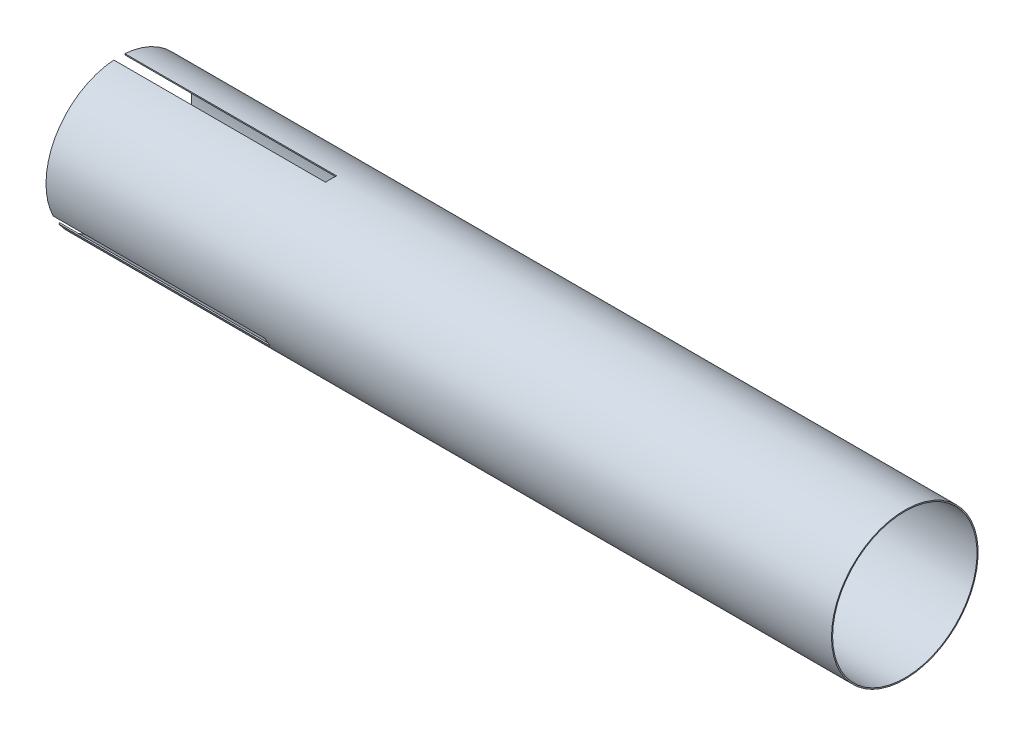
from build123d import *

# Parameters (mm, degrees)
ESQUISSE1_W                  = 816
ESQUISSE1_H                  = 1.182
ESQUISSE2_W                  = 220
ESQUISSE2_H                  = 11.482
ENL_V_MAT_EXTRU_1_DEPTH      = 824.081644947
R_P_TITION_CIRCULAIRE1_COUNT = 3
R_P_TITION_CIRCULAIRE1_ANGLE = 240


with BuildPart() as part:
    # Esquisse1 → Révolution1 (revolve)
    with BuildSketch(Plane.XY):
        with Locations((408, 75.591)):
            Rectangle(ESQUISSE1_W, ESQUISSE1_H)
    revolve(axis=Axis((0, 0, 0), (1, 0, 0)))

    # Esquisse2 → Enlèv. mat.-Extru.1 (cut, through all)
    with BuildSketch(Plane(origin=(0, 0, 0), x_dir=(1, 0, 0), z_dir=(0, 1, 0))):
        with Locations((110, 0)):
            Rectangle(ESQUISSE2_W, ESQUISSE2_H)
    enl_v_mat_extru_1 = extrude(amount=ENL_V_MAT_EXTRU_1_DEPTH, mode=Mode.SUBTRACT)

    # Répétition circulaire1: Enlèv. mat.-Extru.1 ×3 about axis
    r_p_tition_circulaire1_axis = Axis((816, 0, 0), (-1, 0, 0))
    for i in range(1, R_P_TITION_CIRCULAIRE1_COUNT):
        add(enl_v_mat_extru_1.rotate(r_p_tition_circulaire1_axis, i * R_P_TITION_CIRCULAIRE1_ANGLE / (R_P_TITION_CIRCULAIRE1_COUNT - 1)), mode=Mode.SUBTRACT)


solid = part.part
